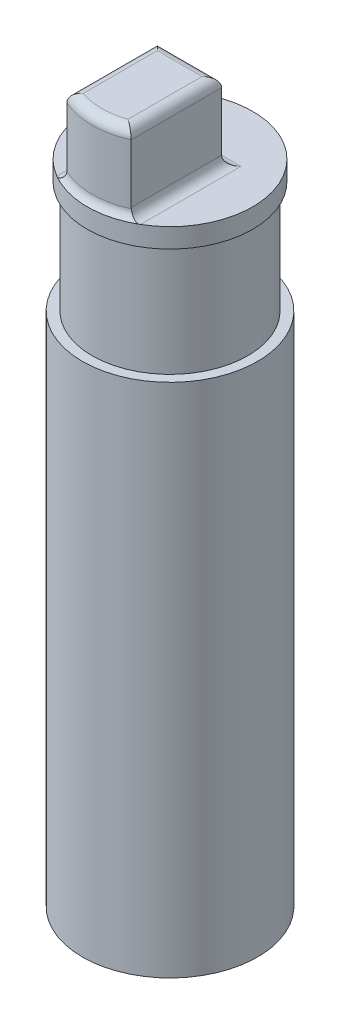
from build123d import *

# Parameters (mm, degrees)
CROQUIS1_R              = 9
SALIENTE_EXTRUIR1_DEPTH = 53
CROQUIS2_R              = 8
SALIENTE_EXTRUIR2_DEPTH = 11.5
CROQUIS3_R              = 8.5
SALIENTE_EXTRUIR3_DEPTH = 2
SALIENTE_EXTRUIR4_DEPTH = 8
REDONDEO1_R             = 1
REDONDEO2_R             = 1


with BuildPart() as part:
    # Croquis1 → Saliente-Extruir1 (new body)
    with BuildSketch(Plane(origin=(0, 0, 0), x_dir=(1, 0, 0), z_dir=(0, 1, 0))):
        with Locations(Location((0, 0, 0), (0, 0, 270))):
            Circle(CROQUIS1_R)
    extrude(amount=SALIENTE_EXTRUIR1_DEPTH)

    # Croquis2 → Saliente-Extruir2 (add)
    with BuildSketch(Plane(origin=(0, 53, 0), x_dir=(1, 0, 0), z_dir=(0, 1, 0))):
        with Locations(Location((0, 0, 0), (0, 0, 270))):
            Circle(CROQUIS2_R)
    extrude(amount=SALIENTE_EXTRUIR2_DEPTH)

    # Croquis3 → Saliente-Extruir3 (add)
    with BuildSketch(Plane(origin=(0, 64.5, 0), x_dir=(1, 0, 0), z_dir=(0, 1, 0))):
        with Locations(Location((0, 0, 0), (0, 0, 270))):
            Circle(CROQUIS3_R)
    extrude(amount=SALIENTE_EXTRUIR3_DEPTH)

    # Croquis4 → Saliente-Extruir4 (add)
    with BuildSketch(Plane(origin=(0, 66.5, 0), x_dir=(1, 0, 0), z_dir=(0, 1, 0))):
        with BuildLine():
            Line((-3.3, -7.287660804), (-3.3, 2))
            Line((-3.3, 2), (3.3, 2))
            Line((3.3, 2), (3.3, -7.287660804))
            ThreePointArc((3.3, -7.287660804), (0, -8), (-3.3, -7.287660804))
        make_face()
    extrude(amount=SALIENTE_EXTRUIR4_DEPTH)

    # Redondeo1
    # the kernel refuses this fillet: 1 mm, written as the material it adds along each edge
    with BuildSketch(Plane(origin=(0, 66.5, 0), x_dir=(0.6410468977600248, 0, 0.7675017100125893), z_dir=(0.7675017100125893, 0, -0.6410468977600248))) as redondeo1_piece_1_section:
        with BuildLine():
            CenterArc((9, -0.866025404), REDONDEO1_R, 120, 60)
            Line((8, -0.866025404), (7.98, -0.866025404))
            Line((7.98, -0.866025404), (7.98, 0))
            Line((7.98, 0), (8, 0.02))
            ThreePointArc((8, 0.02), (8.25, 0.02), (8.49, 0.017320508))
            Line((8.49, 0.017320508), (8.5, 0))
        make_face()
    redondeo1_piece_1 = revolve(axis=Axis((0, 66.5, 0), (0, -1, 0)), revolution_arc=79.739856792, mode=Mode.PRIVATE)
    redondeo1_piece_1 = split(redondeo1_piece_1, bisect_by=Plane(origin=(3.3, 66.860958569, 8.125198581), z_dir=(-1, 0, 0)), keep=Keep.TOP, mode=Mode.PRIVATE)
    redondeo1_piece_1 = split(redondeo1_piece_1, bisect_by=Plane(origin=(-3.3, 66.860958569, 8.125198581), z_dir=(1, 0, 0)), keep=Keep.TOP, mode=Mode.PRIVATE)
    add(redondeo1_piece_1)
    with BuildSketch(Plane(origin=(3.3, 66.5, -2), x_dir=(1, 0, 0), z_dir=(0, 0, 1))) as redondeo1_piece_2_section:
        with BuildLine():
            CenterArc((REDONDEO1_R, REDONDEO1_R), REDONDEO1_R, 180, 90)
            Line((0, REDONDEO1_R), (-REDONDEO1_R * 0.02, REDONDEO1_R))
            Line((-REDONDEO1_R * 0.02, REDONDEO1_R), (-REDONDEO1_R * 0.02, -REDONDEO1_R * 0.02))
            Line((-REDONDEO1_R * 0.02, -REDONDEO1_R * 0.02), (REDONDEO1_R, -REDONDEO1_R * 0.02))
            Line((REDONDEO1_R, -REDONDEO1_R * 0.02), (REDONDEO1_R, 0))
        make_face()
    redondeo1_piece_2 = extrude(amount=11.787660804, mode=Mode.PRIVATE)
    redondeo1_piece_2 = redondeo1_piece_2 & Plane(origin=(0, 66.727902146, 0), x_dir=(0.4124999999999996, 0, 0.9109576005501028), z_dir=(0, -1, 0)) * Cylinder(8, 28, mode=Mode.PRIVATE)
    add(redondeo1_piece_2)
    with BuildSketch(Plane(origin=(-3.3, 66.5, -2), x_dir=(0, 0, -1), z_dir=(1, 0, 0))) as redondeo1_piece_3:
        with BuildLine():
            CenterArc((REDONDEO1_R, REDONDEO1_R), REDONDEO1_R, 180, 90)
            Line((0, REDONDEO1_R), (-REDONDEO1_R * 0.02, REDONDEO1_R))
            Line((-REDONDEO1_R * 0.02, REDONDEO1_R), (-REDONDEO1_R * 0.02, -REDONDEO1_R * 0.02))
            Line((-REDONDEO1_R * 0.02, -REDONDEO1_R * 0.02), (REDONDEO1_R, -REDONDEO1_R * 0.02))
            Line((REDONDEO1_R, -REDONDEO1_R * 0.02), (REDONDEO1_R, 0))
        make_face()
    extrude(amount=6.6)
    with BuildSketch(Plane(origin=(-3.3, 66.5, 9.787660804), x_dir=(-1, 0, 0), z_dir=(0, 0, -1))) as redondeo1_piece_4_section:
        with BuildLine():
            CenterArc((REDONDEO1_R, REDONDEO1_R), REDONDEO1_R, 180, 90)
            Line((0, REDONDEO1_R), (-REDONDEO1_R * 0.02, REDONDEO1_R))
            Line((-REDONDEO1_R * 0.02, REDONDEO1_R), (-REDONDEO1_R * 0.02, -REDONDEO1_R * 0.02))
            Line((-REDONDEO1_R * 0.02, -REDONDEO1_R * 0.02), (REDONDEO1_R, -REDONDEO1_R * 0.02))
            Line((REDONDEO1_R, -REDONDEO1_R * 0.02), (REDONDEO1_R, 0))
        make_face()
    redondeo1_piece_4 = extrude(amount=11.787660804, mode=Mode.PRIVATE)
    redondeo1_piece_4 = redondeo1_piece_4 & Plane(origin=(0, 66.727902035, 0), x_dir=(0.4124999999999996, 0, 0.9109576005501028), z_dir=(0, -1, 0)) * Cylinder(8, 28, mode=Mode.PRIVATE)
    add(redondeo1_piece_4)
    with BuildSketch(Plane(origin=(0, 66.5, 0), x_dir=(0.6410468977600248, 0, 0.7675017100125893), z_dir=(0.7675017100125893, 0, -0.6410468977600248))) as redondeo1_piece_5a_section:
        with BuildLine():
            CenterArc((9, -0.866025404), REDONDEO1_R, 120, 60)
            Line((8, -0.866025404), (7.98, -0.866025404))
            Line((7.98, -0.866025404), (7.98, 0))
            Line((7.98, 0), (8, 0.02))
            ThreePointArc((8, 0.02), (8.25, 0.02), (8.49, 0.017320508))
            Line((8.49, 0.017320508), (8.5, 0))
        make_face()
    redondeo1_piece_5a = revolve(axis=Axis((0, 66.5, 0), (0, -1, 0)), revolution_arc=79.739856792, mode=Mode.PRIVATE)
    redondeo1_piece_5a = split(redondeo1_piece_5a, bisect_by=Plane(origin=(3.3, 66.711912265, 6.883204996), z_dir=(1, 0, 0)), keep=Keep.TOP, mode=Mode.PRIVATE)
    with BuildSketch(Plane(origin=(3.3, 66.5, -2), x_dir=(1, 0, 0), z_dir=(0, 0, 1))) as redondeo1_piece_5b_section:
        with BuildLine():
            CenterArc((REDONDEO1_R, REDONDEO1_R), REDONDEO1_R, 180, 90)
            Line((0, REDONDEO1_R), (-REDONDEO1_R * 0.02, REDONDEO1_R))
            Line((-REDONDEO1_R * 0.02, REDONDEO1_R), (-REDONDEO1_R * 0.02, -REDONDEO1_R * 0.02))
            Line((-REDONDEO1_R * 0.02, -REDONDEO1_R * 0.02), (REDONDEO1_R, -REDONDEO1_R * 0.02))
            Line((REDONDEO1_R, -REDONDEO1_R * 0.02), (REDONDEO1_R, 0))
        make_face()
    redondeo1_piece_5b = extrude(amount=11.787660804, mode=Mode.PRIVATE)
    redondeo1_piece_5b = redondeo1_piece_5b & Plane(origin=(0, 66.724587575, 0), x_dir=(0, 0, 1), z_dir=(0, -1, 0)) * Cylinder(8.5, 28, mode=Mode.PRIVATE)
    redondeo1_piece_5b = redondeo1_piece_5b - Plane(origin=(0, 66.724587575, 0), x_dir=(0.4124999999999996, 0, 0.9109576005501028), z_dir=(0, -1, 0)) * Cylinder(8, 28, mode=Mode.PRIVATE)
    redondeo1_piece_5 = redondeo1_piece_5a & redondeo1_piece_5b
    add(redondeo1_piece_5)
    with BuildSketch(Plane(origin=(0, 66.5, 0), x_dir=(0.6410468977600248, 0, 0.7675017100125893), z_dir=(0.7675017100125893, 0, -0.6410468977600248))) as redondeo1_piece_6a_section:
        with BuildLine():
            CenterArc((9, -0.866025404), REDONDEO1_R, 120, 60)
            Line((8, -0.866025404), (7.98, -0.866025404))
            Line((7.98, -0.866025404), (7.98, 0))
            Line((7.98, 0), (8, 0.02))
            ThreePointArc((8, 0.02), (8.25, 0.02), (8.49, 0.017320508))
            Line((8.49, 0.017320508), (8.5, 0))
        make_face()
    redondeo1_piece_6a = revolve(axis=Axis((0, 66.5, 0), (0, -1, 0)), revolution_arc=79.739856792, mode=Mode.PRIVATE)
    redondeo1_piece_6a = split(redondeo1_piece_6a, bisect_by=Plane(origin=(-3.3, 66.71191226, 6.883204989), z_dir=(-1, 0, 0)), keep=Keep.TOP, mode=Mode.PRIVATE)
    with BuildSketch(Plane(origin=(-3.3, 66.5, 9.787660804), x_dir=(-1, 0, 0), z_dir=(0, 0, -1))) as redondeo1_piece_6b_section:
        with BuildLine():
            CenterArc((REDONDEO1_R, REDONDEO1_R), REDONDEO1_R, 180, 90)
            Line((0, REDONDEO1_R), (-REDONDEO1_R * 0.02, REDONDEO1_R))
            Line((-REDONDEO1_R * 0.02, REDONDEO1_R), (-REDONDEO1_R * 0.02, -REDONDEO1_R * 0.02))
            Line((-REDONDEO1_R * 0.02, -REDONDEO1_R * 0.02), (REDONDEO1_R, -REDONDEO1_R * 0.02))
            Line((REDONDEO1_R, -REDONDEO1_R * 0.02), (REDONDEO1_R, 0))
        make_face()
    redondeo1_piece_6b = extrude(amount=11.787660804, mode=Mode.PRIVATE)
    redondeo1_piece_6b = redondeo1_piece_6b & Plane(origin=(0, 66.72458755, 0), x_dir=(0, 0, 1), z_dir=(0, -1, 0)) * Cylinder(8.5, 28, mode=Mode.PRIVATE)
    redondeo1_piece_6b = redondeo1_piece_6b - Plane(origin=(0, 66.72458755, 0), x_dir=(0.4124999999999996, 0, 0.9109576005501028), z_dir=(0, -1, 0)) * Cylinder(8, 28, mode=Mode.PRIVATE)
    redondeo1_piece_6 = redondeo1_piece_6a & redondeo1_piece_6b
    add(redondeo1_piece_6)
    with BuildSketch(Plane(origin=(3.3, 66.5, -4.5), x_dir=(1, 0, 0), z_dir=(0, 0, 1))) as redondeo1_piece_7a_section:
        with BuildLine():
            CenterArc((REDONDEO1_R, REDONDEO1_R), REDONDEO1_R, 180, 90)
            Line((0, REDONDEO1_R), (-REDONDEO1_R * 0.02, REDONDEO1_R))
            Line((-REDONDEO1_R * 0.02, REDONDEO1_R), (-REDONDEO1_R * 0.02, -REDONDEO1_R * 0.02))
            Line((-REDONDEO1_R * 0.02, -REDONDEO1_R * 0.02), (REDONDEO1_R, -REDONDEO1_R * 0.02))
            Line((REDONDEO1_R, -REDONDEO1_R * 0.02), (REDONDEO1_R, 0))
        make_face()
    redondeo1_piece_7a = extrude(amount=14.287660804, mode=Mode.PRIVATE)
    redondeo1_piece_7a = split(redondeo1_piece_7a, bisect_by=Plane(origin=(3.526395114, 66.726395114, -2), z_dir=(0, 0, -1)), keep=Keep.TOP, mode=Mode.PRIVATE)
    with BuildSketch(Plane(origin=(-3.3, 66.5, -2), x_dir=(0, 0, -1), z_dir=(1, 0, 0))) as redondeo1_piece_7b_section:
        with BuildLine():
            CenterArc((REDONDEO1_R, REDONDEO1_R), REDONDEO1_R, 180, 90)
            Line((0, REDONDEO1_R), (-REDONDEO1_R * 0.02, REDONDEO1_R))
            Line((-REDONDEO1_R * 0.02, REDONDEO1_R), (-REDONDEO1_R * 0.02, -REDONDEO1_R * 0.02))
            Line((-REDONDEO1_R * 0.02, -REDONDEO1_R * 0.02), (REDONDEO1_R, -REDONDEO1_R * 0.02))
            Line((REDONDEO1_R, -REDONDEO1_R * 0.02), (REDONDEO1_R, 0))
        make_face()
    redondeo1_piece_7b = extrude(amount=9.1, mode=Mode.PRIVATE)
    redondeo1_piece_7b = split(redondeo1_piece_7b, bisect_by=Plane(origin=(3.3, 66.726395114, -2.226395114), z_dir=(1, 0, 0)), keep=Keep.TOP, mode=Mode.PRIVATE)
    redondeo1_piece_7 = redondeo1_piece_7a & redondeo1_piece_7b
    add(redondeo1_piece_7)
    with BuildSketch(Plane(origin=(-5.8, 66.5, -2), x_dir=(0, 0, -1), z_dir=(1, 0, 0))) as redondeo1_piece_8a_section:
        with BuildLine():
            CenterArc((REDONDEO1_R, REDONDEO1_R), REDONDEO1_R, 180, 90)
            Line((0, REDONDEO1_R), (-REDONDEO1_R * 0.02, REDONDEO1_R))
            Line((-REDONDEO1_R * 0.02, REDONDEO1_R), (-REDONDEO1_R * 0.02, -REDONDEO1_R * 0.02))
            Line((-REDONDEO1_R * 0.02, -REDONDEO1_R * 0.02), (REDONDEO1_R, -REDONDEO1_R * 0.02))
            Line((REDONDEO1_R, -REDONDEO1_R * 0.02), (REDONDEO1_R, 0))
        make_face()
    redondeo1_piece_8a = extrude(amount=9.1, mode=Mode.PRIVATE)
    redondeo1_piece_8a = split(redondeo1_piece_8a, bisect_by=Plane(origin=(-3.3, 66.726395114, -2.226395114), z_dir=(-1, 0, 0)), keep=Keep.TOP, mode=Mode.PRIVATE)
    with BuildSketch(Plane(origin=(-3.3, 66.5, 9.787660804), x_dir=(-1, 0, 0), z_dir=(0, 0, -1))) as redondeo1_piece_8b_section:
        with BuildLine():
            CenterArc((REDONDEO1_R, REDONDEO1_R), REDONDEO1_R, 180, 90)
            Line((0, REDONDEO1_R), (-REDONDEO1_R * 0.02, REDONDEO1_R))
            Line((-REDONDEO1_R * 0.02, REDONDEO1_R), (-REDONDEO1_R * 0.02, -REDONDEO1_R * 0.02))
            Line((-REDONDEO1_R * 0.02, -REDONDEO1_R * 0.02), (REDONDEO1_R, -REDONDEO1_R * 0.02))
            Line((REDONDEO1_R, -REDONDEO1_R * 0.02), (REDONDEO1_R, 0))
        make_face()
    redondeo1_piece_8b = extrude(amount=14.287660804, mode=Mode.PRIVATE)
    redondeo1_piece_8b = split(redondeo1_piece_8b, bisect_by=Plane(origin=(-3.526395114, 66.726395114, -2), z_dir=(0, 0, -1)), keep=Keep.TOP, mode=Mode.PRIVATE)
    redondeo1_piece_8 = redondeo1_piece_8a & redondeo1_piece_8b
    add(redondeo1_piece_8)

    # Redondeo2
    redondeo2_edges = [part.edges().sort_by_distance(p)[0] for p in [
        (0, 74.5, 8),
        (3.3, 74.5, 2.643830402),
        (0, 74.5, -2),
        (-3.3, 74.5, 2.643830402),
    ]]
    fillet(redondeo2_edges, radius=REDONDEO2_R)


solid = part.part
